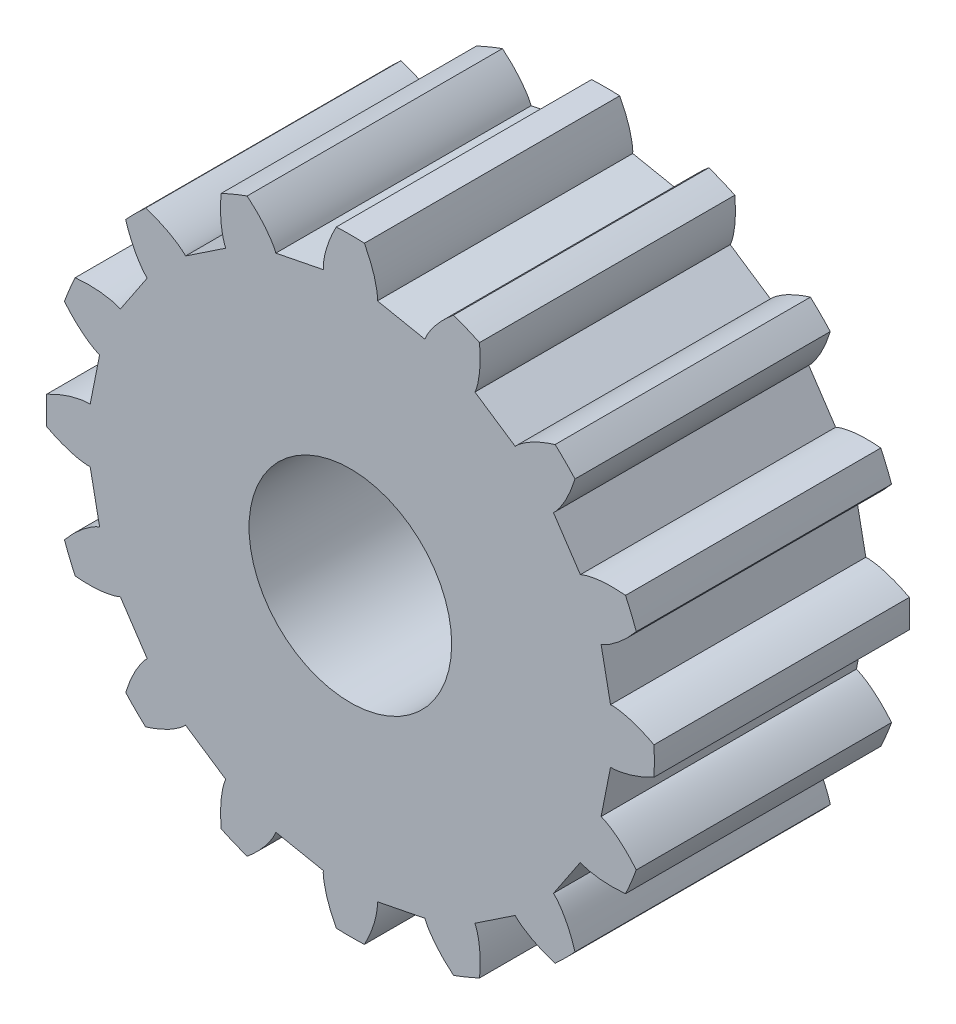
from build123d import *

# Parameters (mm, degrees)
SKETCH1_R               = 14.2875
BOSS_EXTRUDE1_DEPTH     = 12
CUT_EXTRUDE2_DEPTH      = 13
CIRPATTERN1_COUNT       = 16
CUT_EXTRUDE4_DEPTH      = 14
CUT_EXTRUDE4_DEPTH_BACK = 14
SKETCH3_R               = 4.7625


with BuildPart() as part:
    # Sketch1 → Boss-Extrude1 (new body)
    with BuildSketch(Plane.XY):
        Circle(SKETCH1_R)
    extrude(amount=BOSS_EXTRUDE1_DEPTH)

    # Sketch2 → Cut-Extrude2 (cut, symmetric)
    with BuildSketch(Plane.XY):
        with BuildLine():
            add(Edge.make_bspline(
                [(12.229398428, 1.272996615), (12.232569464, 1.273286616), (12.24147496, 1.27397705), (12.258355017, 1.274796659), (12.285950585, 1.275443331), (12.321178928, 1.275251476), (12.366773102, 1.273836189), (12.420546418, 1.270667153), (12.479687741, 1.26561074), (12.544059737, 1.258411302), (12.608289269, 1.249727247), (12.672354395, 1.239667418), (12.736156846, 1.228386466), (12.813405758, 1.213233983), (12.905973255, 1.192997232), (13.01403689, 1.166335588), (13.136405998, 1.132550383), (13.260856391, 1.094333587), (13.383078241, 1.05362131), (13.506236131, 1.00892567), (13.625159484, 0.963157367), (13.74827665, 0.911985231), (13.861717136, 0.862901529), (13.98829551, 0.803906078), (14.090299927, 0.755125575), (14.195197101, 0.701408819), (14.246179434, 0.67477432), (14.272203516, 0.660956172)],
                knots=[0, 0, 0, 0, 0, 0.005376749, 0.015083688, 0.02853182, 0.04661014, 0.064854849, 0.092110526, 0.119476176, 0.146842496, 0.174208854, 0.201574956, 0.228941013, 0.256307345, 0.307035032, 0.361767352, 0.416499661, 0.471231937, 0.525964282, 0.580696616, 0.635428982, 0.690161387, 0.744893688, 0.799626082, 0.854358407, 0.909090914, 0.909090914, 0.909090914, 0.909090914, 0.909090914], degree=4))
            Line((14.272203516, 0.660956172), (59.935762795, 2.775668965))
            add(Edge.make_bspline(
                [(59.935762795, 2.775668965), (59.931630356, 2.864901825), (59.922571104, 3.049480891), (59.902165694, 3.440419569), (59.877579242, 3.838864849), (59.840808515, 4.384473066), (59.791455691, 5.01973039), (59.724470289, 5.770803476), (59.636018849, 6.621628164), (59.535214074, 7.474533703), (59.422361052, 8.323878311), (59.297279712, 9.17280178), (59.160175965, 10.018977678), (59.010873176, 10.863801486), (58.849682784, 11.705714261), (58.676209407, 12.546100116), (58.491172453, 13.382667924), (58.293497057, 14.218465783), (58.085046948, 15.048188716), (57.862866002, 15.880024995), (57.631950551, 16.700058452), (57.384099029, 17.530991619), (57.133463512, 18.333578353), (56.889087073, 19.073728923), (56.697889707, 19.634977834), (56.527852443, 20.115048211), (56.4659571, 20.288017853), (56.435627038, 20.372039682)],
                knots=[0.083333333, 0.083333333, 0.083333333, 0.083333333, 0.083333333, 0.103174603, 0.123015873, 0.142857143, 0.162698412, 0.202380952, 0.242063492, 0.281746032, 0.321428571, 0.361111111, 0.400793651, 0.44047619, 0.48015873, 0.51984127, 0.55952381, 0.599206349, 0.638888889, 0.678571429, 0.718253968, 0.757936508, 0.797619048, 0.837301588, 0.876984127, 0.896825397, 0.916666667, 0.916666667, 0.916666667, 0.916666667, 0.916666667], degree=4))
            Line((56.435627038, 20.372039682), (13.438733689, 4.851091949))
            add(Edge.make_bspline(
                [(11.785645616, 3.503892648), (11.78868625, 3.504838225), (11.797178074, 3.507608333), (11.813086863, 3.513310832), (11.838829315, 3.523273751), (11.87130264, 3.536932305), (11.912884557, 3.555687995), (11.961351885, 3.579193959), (12.014056338, 3.606497881), (12.070773202, 3.63778339), (12.126790307, 3.670385988), (12.182129036, 3.704196722), (12.236757782, 3.739035103), (12.302327866, 3.78259605), (12.380104813, 3.836716418), (12.469739624, 3.902702728), (12.5698649, 3.980744818), (12.670217137, 4.063677637), (12.767555488, 4.148063154), (12.864234261, 4.236487024), (12.956590341, 4.324281419), (13.050753042, 4.418673208), (13.136774866, 4.507432431), (13.231141453, 4.610376567), (13.306713757, 4.694479276), (13.383069595, 4.784249498), (13.419978548, 4.82836666), (13.438733689, 4.851091949)],
                knots=[0, 0, 0, 0, 0, 0.005376749, 0.015083688, 0.02853182, 0.04661014, 0.064854849, 0.092110526, 0.119476176, 0.146842496, 0.174208854, 0.201574956, 0.228941013, 0.256307345, 0.307035032, 0.361767352, 0.416499661, 0.471231937, 0.525964282, 0.580696616, 0.635428982, 0.690161387, 0.744893688, 0.799626082, 0.854358407, 0.909090915, 0.909090915, 0.909090915, 0.909090915, 0.909090915], degree=4))
            Line((11.785645616, 3.503892648), (12.229398428, 1.272996615))
        make_face()
    cut_extrude2 = extrude(amount=CUT_EXTRUDE2_DEPTH, both=True, mode=Mode.SUBTRACT)

    # CirPattern1: Cut-Extrude2 ×16 about axis
    cirpattern1_axis = Axis((0, 0, -0.6), (0, 0, 1))
    for i in range(1, CIRPATTERN1_COUNT):
        add(cut_extrude2.rotate(cirpattern1_axis, i * 360 / CIRPATTERN1_COUNT), mode=Mode.SUBTRACT)

    # Sketch3 → Cut-Extrude4 (cut, two sides: drawn at the far end of the back side and taken through both)
    with BuildSketch(Plane.XY.offset(-CUT_EXTRUDE4_DEPTH_BACK)):
        Circle(SKETCH3_R)
    extrude(amount=CUT_EXTRUDE4_DEPTH + CUT_EXTRUDE4_DEPTH_BACK, mode=Mode.SUBTRACT)


solid = part.part
